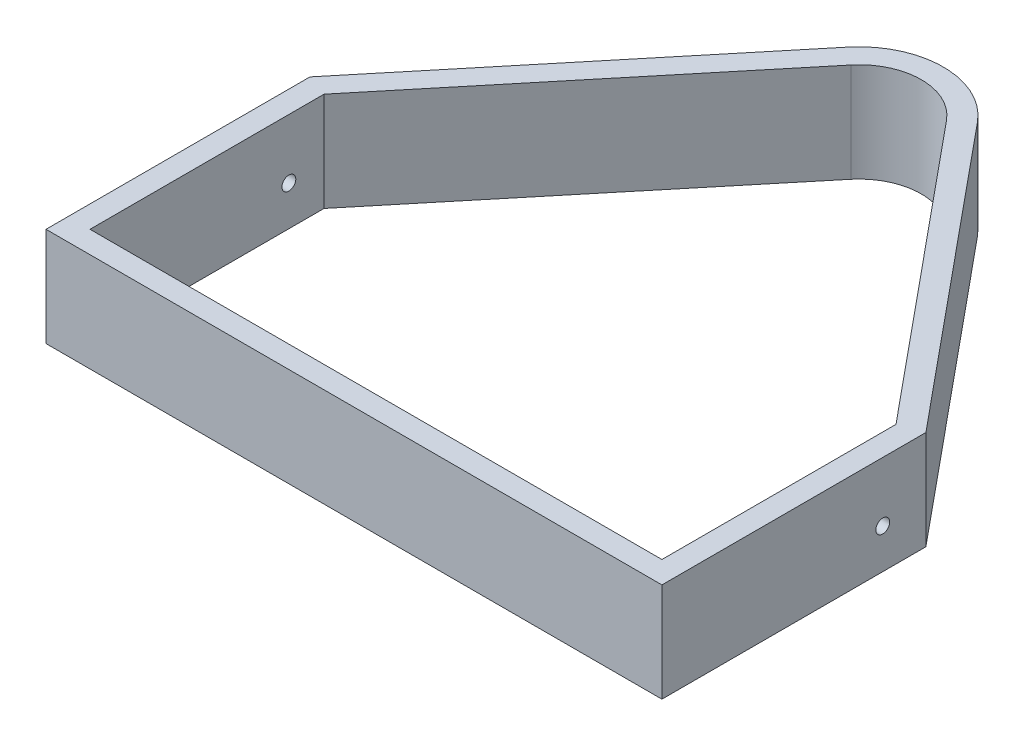
from build123d import *

# Parameters (mm, degrees)
BOSS_EXTRUDE1_DEPTH = 28.575
CUT_EXTRUDE1_REACH  = 278.603
CUT_EXTRUDE1_START  = -82.55
SKETCH2_R           = 2
CUT_EXTRUDE3_REACH  = 278.603
CUT_EXTRUDE3_START  = 82.55
SKETCH2_2_R         = 2


with BuildPart() as part:
    # Sketch1 → Boss-Extrude1 (new body)
    with BuildSketch(Plane(origin=(0, 0, 0), x_dir=(1, 0, 0), z_dir=(0, 1, 0))):
        with BuildLine():
            Line((-88.9, 0), (88.9, 0))
            Line((88.9, 0), (88.9, 76.2))
            Line((88.9, 76.2), (18.702682169, 161.291999073))
            ThreePointArc((18.702682169, 161.291999073), (0, 170.108527998), (-18.702682169, 161.291999073))
            Line((-18.702682169, 161.291999073), (-88.9, 76.2))
            Line((-88.9, 76.2), (-88.9, 0))
        make_face()
        with BuildLine():
            Line((-82.55, 6.35), (-82.55, 73.918790961))
            Line((-82.55, 73.918790961), (-13.804360649, 157.251089982))
            ThreePointArc((-13.804360649, 157.251089982), (0, 163.758527998), (13.804360649, 157.251089982))
            Line((13.804360649, 157.251089982), (82.55, 73.918790961))
            Line((82.55, 73.918790961), (82.55, 6.35))
            Line((82.55, 6.35), (-82.55, 6.35))
        make_face(mode=Mode.SUBTRACT)
    extrude(amount=BOSS_EXTRUDE1_DEPTH)

    # Sketch2 → Cut-Extrude1 (cut, up to next)
    with BuildSketch(Plane(origin=(0, 0, 0), x_dir=(0, 0, -1), z_dir=(1, 0, 0)).offset(CUT_EXTRUDE1_START), mode=Mode.PRIVATE) as cut_extrude1_sk1:
        with Locations((63.758790961, 11.43)):
            Circle(SKETCH2_R)
    cut_extrude1_tool1 = extrude(cut_extrude1_sk1.sketch, amount=-CUT_EXTRUDE1_REACH, mode=Mode.PRIVATE) & part.part
    add(cut_extrude1_tool1.solids().sort_by_distance((-82.55, 11.43, -63.758791))[0], mode=Mode.SUBTRACT)

    # Sketch2<2> → Cut-Extrude3 (cut, up to next)
    with BuildSketch(Plane(origin=(0, 0, 0), x_dir=(0, 0, -1), z_dir=(1, 0, 0)).offset(CUT_EXTRUDE3_START), mode=Mode.PRIVATE) as cut_extrude3_sk1:
        with Locations((63.758790961, 11.43)):
            Circle(SKETCH2_2_R)
    cut_extrude3_tool1 = extrude(cut_extrude3_sk1.sketch, amount=CUT_EXTRUDE3_REACH, mode=Mode.PRIVATE) & part.part
    add(cut_extrude3_tool1.solids().sort_by_distance((82.55, 11.43, -63.758791))[0], mode=Mode.SUBTRACT)


solid = part.part
